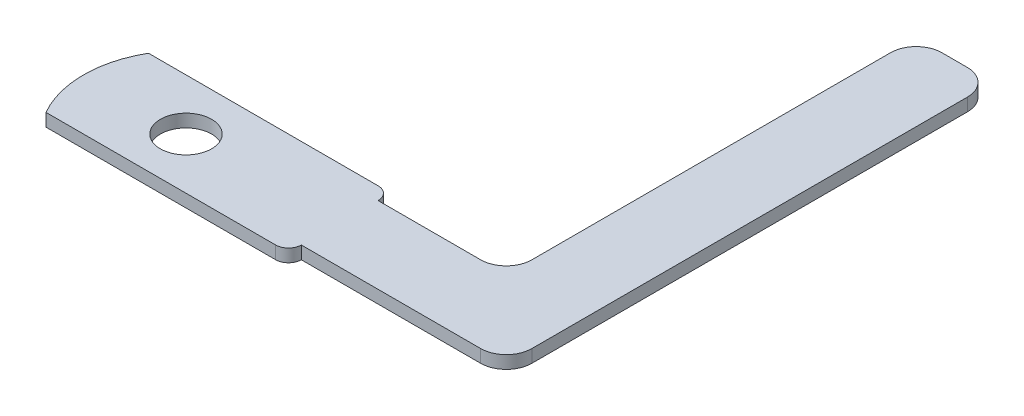
from build123d import *

# Parameters (mm, degrees)
SKETCH1_R           = 3.175
BOSS_EXTRUDE1_DEPTH = 1.5875
FILLET1_R           = 3.175
FILLET2_R           = 1.5875


with BuildPart() as part:
    # Sketch1 → Boss-Extrude1 (new body)
    with BuildSketch(Plane(origin=(0, 0, 0), x_dir=(1, 0, 0), z_dir=(0, 1, 0))):
        with BuildLine():
            Line((-17.348522628, 0), (12.7, 0))
            Line((12.7, 0), (12.7, 1.5875))
            Line((12.7, 1.5875), (38.1, 1.5875))
            Line((38.1, 1.5875), (38.1, 61.9125))
            Line((38.1, 61.9125), (28.575, 61.9125))
            Line((28.575, 61.9125), (28.575, 11.1125))
            Line((28.575, 11.1125), (12.7, 11.1125))
            Line((12.7, 11.1125), (12.7, 12.7))
            Line((12.7, 12.7), (-17.348522628, 12.7))
            ThreePointArc((-17.348522628, 12.7), (-19.05, 6.35), (-17.348522628, 0))
        make_face()
        with Locations(Location((-6.35, 6.35, 0), (0, 0, 270))):
            Circle(SKETCH1_R, mode=Mode.SUBTRACT)
    extrude(amount=BOSS_EXTRUDE1_DEPTH)

    # Fillet1
    fillet1_edges = [part.edges().sort_by_distance(p)[0] for p in [
        (28.575, 0.79375, -11.1125),
        (28.575, 0.79375, -61.9125),
        (38.1, 0.79375, -61.9125),
        (38.1, 0.79375, -1.5875),
    ]]
    fillet(fillet1_edges, radius=FILLET1_R)

    # Fillet2
    fillet2_edges = [part.edges().sort_by_distance(p)[0] for p in [
        (12.7, 0.79375, 0),
        (12.7, 0.79375, -12.7),
    ]]
    fillet(fillet2_edges, radius=FILLET2_R - 0.0001)  # a hair under: the kernel refuses the full size


solid = part.part
